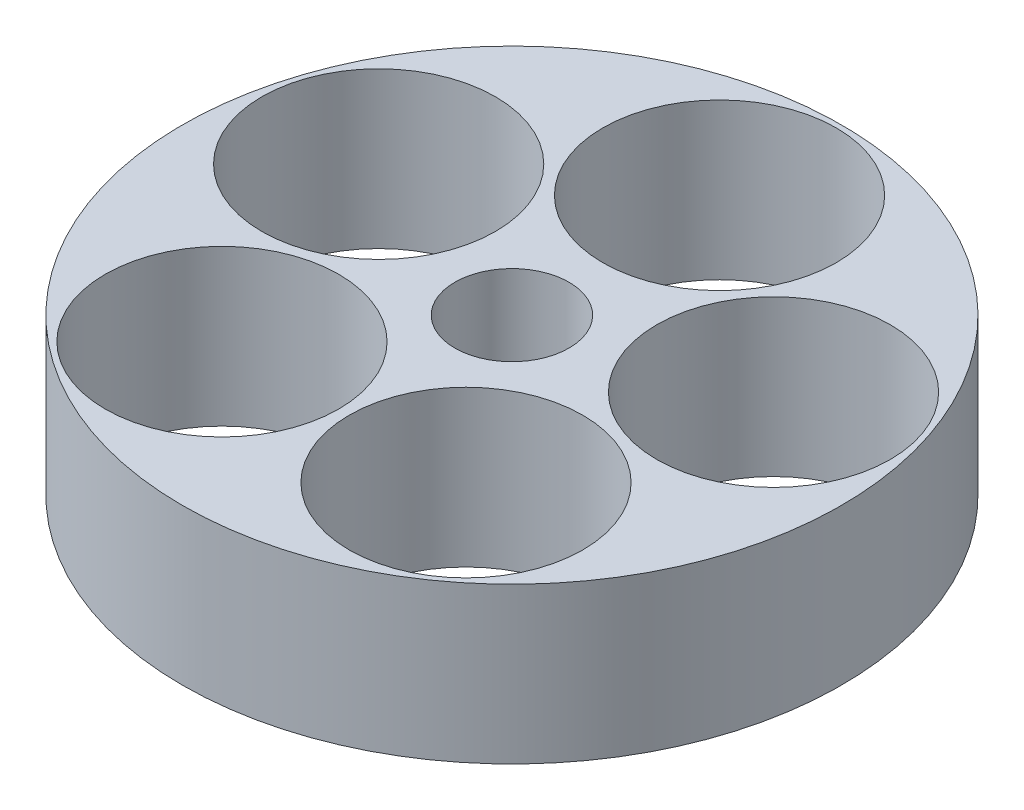
from build123d import *

# Parameters (mm, degrees)
SKETCH1_R           = 63.5
SKETCH1_R_2         = 22.5
SKETCH1_R_3         = 11
BOSS_EXTRUDE1_DEPTH = 30


with BuildPart() as part:
    # Sketch1 → Boss-Extrude1 (new body)
    with BuildSketch(Plane(origin=(0, 0, 0), x_dir=(1, 0, 0), z_dir=(0, 1, 0))):
        Circle(SKETCH1_R)
        with Locations((38.042260652, 12.360679775)):
            Circle(SKETCH1_R_2, mode=Mode.SUBTRACT)
        with Locations((0, 40)):
            Circle(SKETCH1_R_2, mode=Mode.SUBTRACT)
        with Locations((-38.042260652, 12.360679775)):
            Circle(SKETCH1_R_2, mode=Mode.SUBTRACT)
        with Locations((-23.511410092, -32.360679775)):
            Circle(SKETCH1_R_2, mode=Mode.SUBTRACT)
        with Locations((23.511410092, -32.360679775)):
            Circle(SKETCH1_R_2, mode=Mode.SUBTRACT)
        Circle(SKETCH1_R_3, mode=Mode.SUBTRACT)
    extrude(amount=BOSS_EXTRUDE1_DEPTH)


solid = part.part
